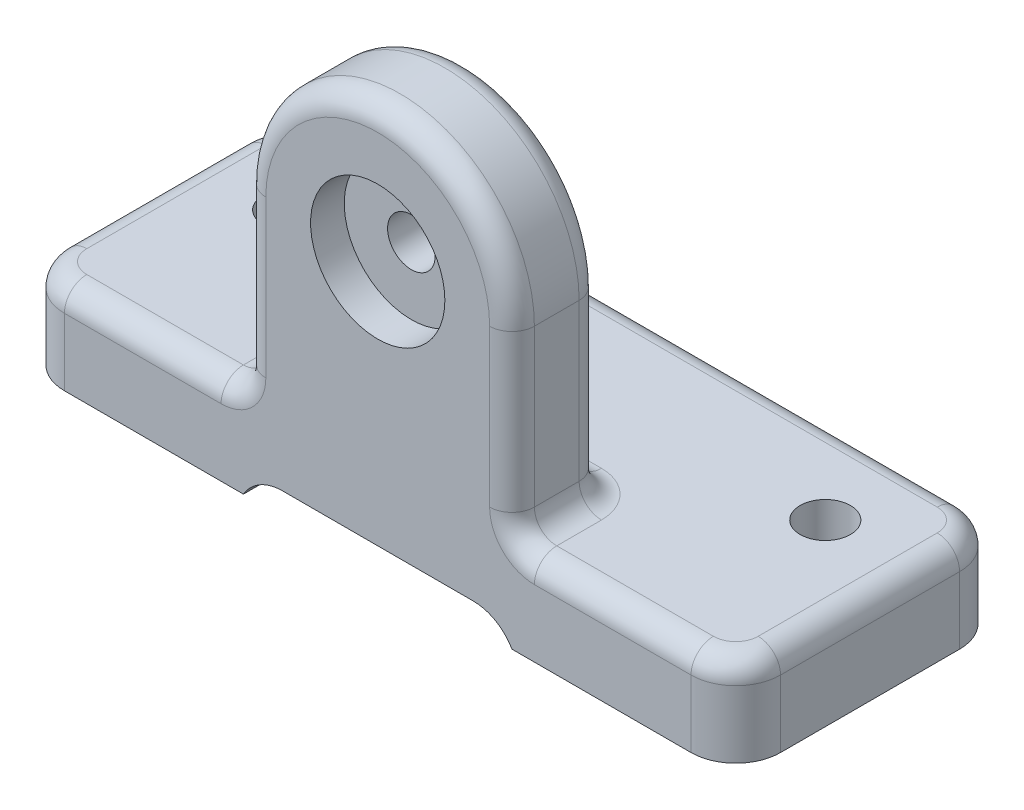
from build123d import *

# Parameters (mm, degrees)
SKETCH1_W                                = 101.6
SKETCH1_H                                = 38.1
BASE_EXTRUDE_DEPTH                       = 12.7
BOSS_EXTRUDE1_DEPTH                      = 12.7
CBORE_FOR_1_4_HEX_HEAD_BOLT1_D           = 6.7564
CBORE_FOR_1_4_HEX_HEAD_BOLT1_CBORE_D     = 19.05
CBORE_FOR_1_4_HEX_HEAD_BOLT1_CBORE_DEPTH = 4.7752
SKETCH10_W                               = 38.1
SKETCH10_H                               = 3.175
CUT_EXTRUDE1_DEPTH                       = 123.994494021
F_9_32_0_28125_DIAMETER_HOLE1_D          = 7.14375
FILLET1_R                                = 6.35
FILLET2_R                                = 3.175


with BuildPart() as part:
    # Sketch1 → Base-Extrude (new body)
    with BuildSketch(Plane(origin=(0, 0, 0), x_dir=(1, 0, 0), z_dir=(0, 1, 0))):
        with Locations((50.8, 19.05)):
            Rectangle(SKETCH1_W, SKETCH1_H)
    extrude(amount=BASE_EXTRUDE_DEPTH)

    # Sketch2 → Boss-Extrude1 (add)
    with BuildSketch(Plane.XY):
        with BuildLine():
            Line((31.75, 0), (31.75, 38.1))
            ThreePointArc((31.75, 38.1), (50.8, 57.15), (69.85, 38.1))
            Line((69.85, 38.1), (69.85, 0))
            Line((69.85, 0), (31.75, 0))
        make_face()
    extrude(amount=-BOSS_EXTRUDE1_DEPTH)

    # CBORE for 1/4 Hex Head Bolt1 (through all)
    with Locations(Plane(origin=(1.103556277, -5.640959644, 0), x_dir=(1, 0, 0), z_dir=(0, 0, 1))):
        with Locations((49.696443723, 43.740959644)):
            CounterBoreHole(CBORE_FOR_1_4_HEX_HEAD_BOLT1_D / 2, CBORE_FOR_1_4_HEX_HEAD_BOLT1_CBORE_D / 2, CBORE_FOR_1_4_HEX_HEAD_BOLT1_CBORE_DEPTH)

    # Sketch10 → Cut-Extrude1 (cut, through all)
    with BuildSketch(Plane(origin=(-1.071270925, 1.162093394, 0), x_dir=(1, 0, 0), z_dir=(0, 0, 1))):
        with Locations((51.871270925, 0.425406606)):
            Rectangle(SKETCH10_W, SKETCH10_H)
    extrude(amount=-CUT_EXTRUDE1_DEPTH, mode=Mode.SUBTRACT)

    # 9/32 (0.28125) Diameter Hole1 (through all)
    with Locations(Plane(origin=(45.908148148, 12.7, 7.855185185), x_dir=(-1, 0, 0), z_dir=(0, 1, 0))):
        with Locations((-42.991851852, -33.255185185), (33.208148148, -33.255185185)):
            Hole(F_9_32_0_28125_DIAMETER_HOLE1_D / 2)

    # Fillet1
    # the kernel refuses this fillet: 6.35 mm, written as the material it adds along each edge
    with BuildSketch(Plane(origin=(31.75, 3.175, 0), x_dir=(0, -1, 0), z_dir=(0, 0, -1))) as fillet1_piece_1:
        with BuildLine():
            CenterArc((6.35, -5.499261314), FILLET1_R, 120, 60)
            Line((0, -5.499261314), (0, 0))
            Line((0, 0), (3.175, 0))
        make_face()
    extrude(amount=38.1)
    with BuildSketch(Plane(origin=(69.85, 3.175, 0), x_dir=(-1, 0, 0), z_dir=(0, 0, -1))) as fillet1_piece_2:
        with BuildLine():
            CenterArc((5.499261314, -6.35), FILLET1_R, 90, 60)
            Line((0, -3.175), (0, 0))
            Line((0, 0), (5.499261314, 0))
        make_face()
    extrude(amount=38.1)
    # the kernel refuses this fillet: 6.35 mm, written as the material it takes off along each edge
    with BuildSketch(Plane(origin=(0, -15.875, -38.1), x_dir=(0, 0, 1), z_dir=(0, 1, 0)), Plane(origin=(0, -15.875, 0), x_dir=(1, 0, 0), z_dir=(0, 1, 0))) as fillet1_2_piece_1:
        with BuildLine():
            CenterArc((FILLET1_R, FILLET1_R), FILLET1_R, 180, 90)
            Line((0, FILLET1_R), (0, 0))
            Line((0, 0), (FILLET1_R, 0))
        make_face()
    extrude(amount=44.45, mode=Mode.SUBTRACT)
    with BuildSketch(Plane(origin=(101.6, -15.875, -38.1), x_dir=(0, 0, 1), z_dir=(0, 1, 0)), Plane(origin=(101.6, -15.875, 0), x_dir=(-1, 0, 0), z_dir=(0, 1, 0))) as fillet1_2_piece_2:
        with BuildLine():
            CenterArc((FILLET1_R, -FILLET1_R), FILLET1_R, 90, 90)
            Line((0, -FILLET1_R), (0, 0))
            Line((0, 0), (FILLET1_R, 0))
        make_face()
    extrude(amount=44.45, mode=Mode.SUBTRACT)

    # Fillet2
    fillet2_edges = [part.edges().sort_by_distance(p)[0] for p in [
        (82.55, 12.7, 0),
        (31.75, 25.4, -12.7),
        (69.85, 25.4, -12.7),
        (31.75, 25.4, 0),
        (69.85, 25.4, 0),
        (50.8, 57.15, 0),
        (31.75, 12.7, -6.35),
        (50.8, 57.15, -12.7),
        (69.85, 12.7, -6.35),
        (50.8, 12.7, -12.7),
        (19.05, 12.7, 0),
        (0, 12.7, -19.05),
        (101.6, 12.7, -19.05),
        (50.8, 12.7, -38.1),
        (1.859871939, 12.7, -36.240128061),
        (99.740128061, 12.7, -36.240128061),
        (99.740128061, 12.7, -1.859871939),
        (1.859871939, 12.7, -1.859871939),
    ]]
    fillet(fillet2_edges, radius=FILLET2_R)


solid = part.part
